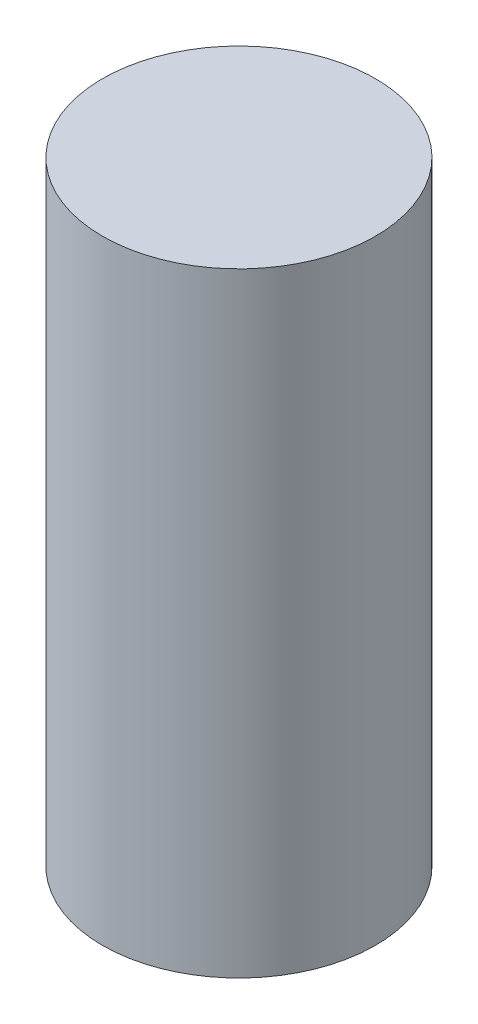
from build123d import *

# Parameters (mm, degrees)
SKETCH1_R           = 4
BOSS_EXTRUDE1_DEPTH = 18


with BuildPart() as part:
    # Sketch1 → Boss-Extrude1 (new body)
    with BuildSketch(Plane(origin=(0, 0, 0), x_dir=(1, 0, 0), z_dir=(0, 1, 0))):
        Circle(SKETCH1_R)
    extrude(amount=BOSS_EXTRUDE1_DEPTH)


solid = part.part
